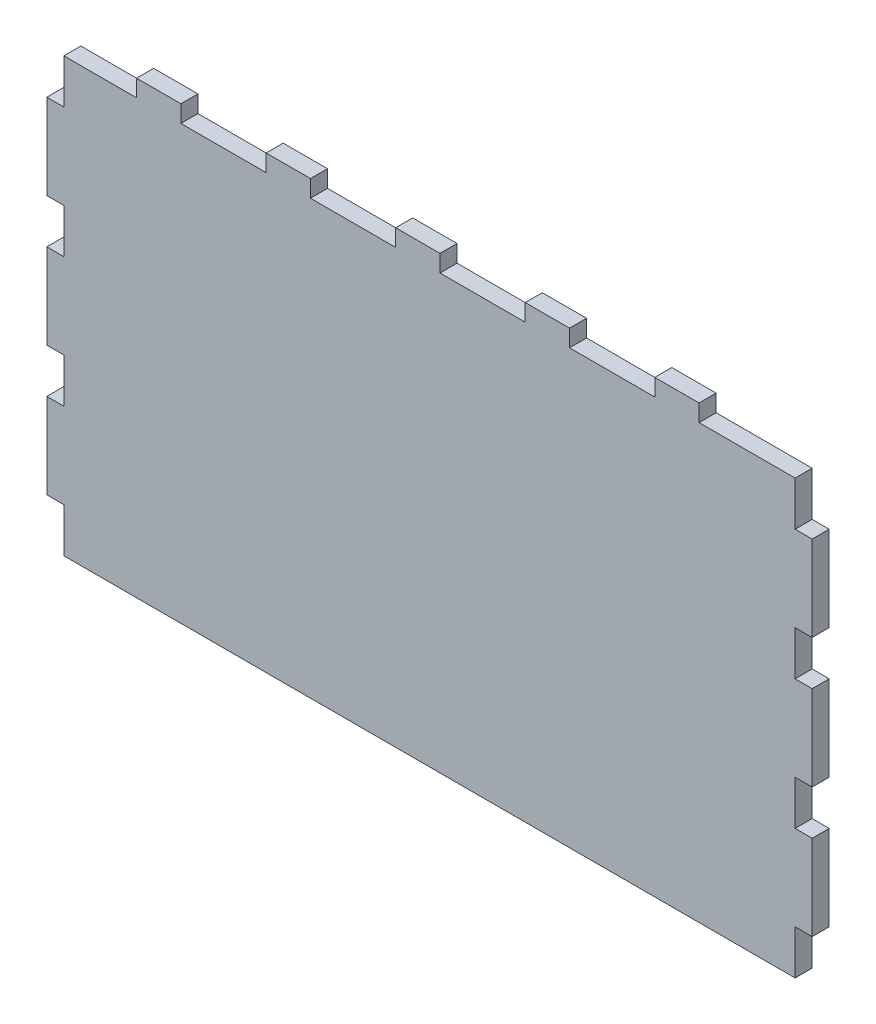
from build123d import *

# Parameters (mm, degrees)
SKETCH1_W               = 134.7
SKETCH1_H               = 76.2
BOSS_EXTRUDE1_DEPTH     = 3
SKETCH2_W               = 3
SKETCH2_H               = 7.8
CUT_EXTRUDE1_DEPTH      = 78.437926754
LPATTERN1_COUNT         = 4
LPATTERN1_PITCH         = 22.8
MIRROR4_COPY_1_SKETCH_W = 3
MIRROR4_COPY_1_SKETCH_H = 7.8
MIRROR4_COPY_1_DEPTH    = 78.437926754
MIRROR4_COPY_2_SKETCH_W = 3
MIRROR4_COPY_2_SKETCH_H = 7.8
MIRROR4_COPY_2_DEPTH    = 78.437926754
MIRROR4_COPY_3_SKETCH_W = 3
MIRROR4_COPY_3_SKETCH_H = 7.8
MIRROR4_COPY_3_DEPTH    = 78.437926754
MIRROR4_COPY_4_SKETCH_W = 3
MIRROR4_COPY_4_SKETCH_H = 7.8
MIRROR4_COPY_4_DEPTH    = 78.437926754
SKETCH3_W               = 7.8
SKETCH3_H               = 3
BOSS_EXTRUDE2_DEPTH     = 3
LPATTERN2_COUNT         = 5
LPATTERN2_PITCH         = 22.8


with BuildPart() as part:
    # Sketch1 → Boss-Extrude1 (new body)
    with BuildSketch(Plane.XY):
        Rectangle(SKETCH1_W, SKETCH1_H)
    extrude(amount=BOSS_EXTRUDE1_DEPTH)

    # Sketch2 → Cut-Extrude1 (cut, through all)
    with BuildSketch(Plane.XY.offset(3)):
        with Locations((-65.85, 34.2)):
            Rectangle(SKETCH2_W, SKETCH2_H)
    cut_extrude1 = extrude(amount=-CUT_EXTRUDE1_DEPTH, mode=Mode.SUBTRACT)

    # LPattern1: Cut-Extrude1 ×4
    with Locations(*[(0, -i * LPATTERN1_PITCH, 0) for i in range(1, LPATTERN1_COUNT)]):
        add(cut_extrude1, mode=Mode.SUBTRACT)

    # Mirror4 copy 1 sketch → Mirror4 copy 1 (cut, through all)
    with BuildSketch(Plane(origin=(0, -22.8, 3), x_dir=(-1, 0, 0), z_dir=(0, 0, 1))):
        with Locations((-65.85, -34.2)):
            Rectangle(MIRROR4_COPY_1_SKETCH_W, MIRROR4_COPY_1_SKETCH_H)
    extrude(amount=-MIRROR4_COPY_1_DEPTH, mode=Mode.SUBTRACT)

    # Mirror4 copy 2 sketch → Mirror4 copy 2 (cut, through all)
    with BuildSketch(Plane(origin=(0, -45.6, 3), x_dir=(-1, 0, 0), z_dir=(0, 0, 1))):
        with Locations((-65.85, -34.2)):
            Rectangle(MIRROR4_COPY_2_SKETCH_W, MIRROR4_COPY_2_SKETCH_H)
    extrude(amount=-MIRROR4_COPY_2_DEPTH, mode=Mode.SUBTRACT)

    # Mirror4 copy 3 sketch → Mirror4 copy 3 (cut, through all)
    with BuildSketch(Plane(origin=(0, -68.4, 3), x_dir=(-1, 0, 0), z_dir=(0, 0, 1))):
        with Locations((-65.85, -34.2)):
            Rectangle(MIRROR4_COPY_3_SKETCH_W, MIRROR4_COPY_3_SKETCH_H)
    extrude(amount=-MIRROR4_COPY_3_DEPTH, mode=Mode.SUBTRACT)

    # Mirror4 copy 4 sketch → Mirror4 copy 4 (cut, through all)
    with BuildSketch(Plane(origin=(0, 0, 3), x_dir=(-1, 0, 0), z_dir=(0, 0, 1))):
        with Locations((-65.85, -34.2)):
            Rectangle(MIRROR4_COPY_4_SKETCH_W, MIRROR4_COPY_4_SKETCH_H)
    extrude(amount=-MIRROR4_COPY_4_DEPTH, mode=Mode.SUBTRACT)

    # Sketch3 → Boss-Extrude2 (add)
    with BuildSketch(Plane(origin=(0, 38.1, 0), x_dir=(1, 0, 0), z_dir=(0, 1, 0))):
        with Locations((-47.65, -1.5)):
            Rectangle(SKETCH3_W, SKETCH3_H)
    boss_extrude2 = extrude(amount=BOSS_EXTRUDE2_DEPTH)

    # LPattern2: Boss-Extrude2 ×5
    with Locations(*[(i * LPATTERN2_PITCH, 0, 0) for i in range(1, LPATTERN2_COUNT)]):
        add(boss_extrude2)


solid = part.part
